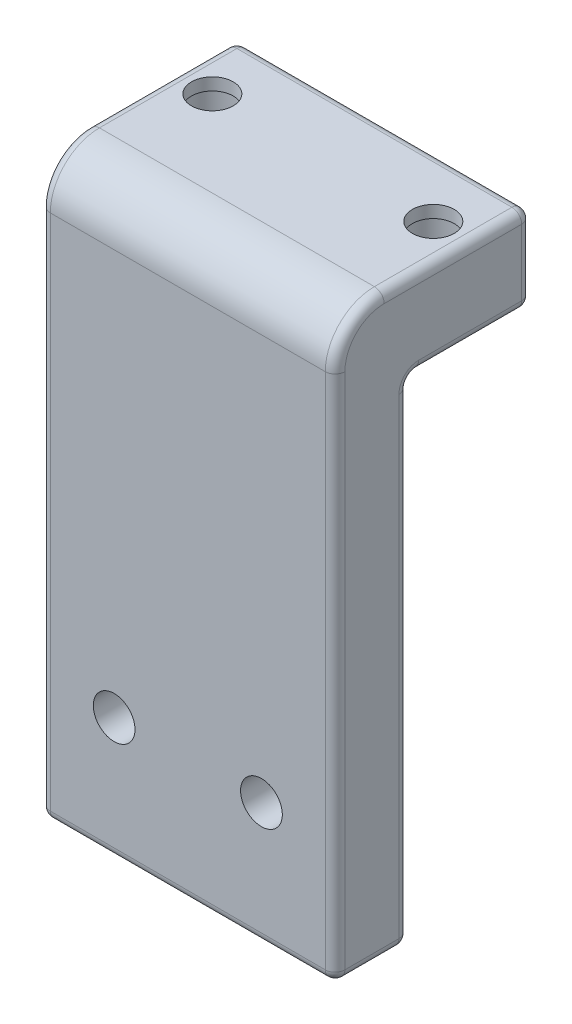
from build123d import *

# Parameters (mm, degrees)
SKETCH2_W           = 24
SKETCH2_H           = 47
BOSS_EXTRUDE1_DEPTH = 6
SKETCH3_W           = 24
SKETCH3_H           = 7
BOSS_EXTRUDE2_DEPTH = 10
HOLE1_OUTLINE_R     = 2.15
HOLE1_DEPTH         = 6
HOLE1_START         = 6
HOLE1_2_OUTLINE_R   = 1.7
HOLE1_2_DEPTH       = 1
FILLET1_R           = 4
FILLET2_R           = 0.8


# Read off the part's stored shape, not the designer's step: Hole1, CBORE for M3 SBHCS1
with BuildPart() as part:
    # Sketch2 → Boss-Extrude1 (new body)
    with BuildSketch(Plane.XY):
        with Locations((12, -16.5)):
            Rectangle(SKETCH2_W, SKETCH2_H)
    extrude(amount=BOSS_EXTRUDE1_DEPTH)

    # Sketch3 → Boss-Extrude2 (add)
    with BuildSketch(Plane(origin=(0, 0, 0), x_dir=(-1, 0, 0), z_dir=(0, 0, -1))):
        with Locations((-12, 3.5)):
            Rectangle(SKETCH3_W, SKETCH3_H)
    extrude(amount=BOSS_EXTRUDE2_DEPTH)

    # Hole1 outline → Hole1 (cut)
    with BuildSketch(Plane(origin=(0, 0, 0), x_dir=(1, 0, 0), z_dir=(0, 1, 0))):
        with Locations((3, 5)):
            Circle(HOLE1_OUTLINE_R)
        with Locations((21, 5)):
            Circle(HOLE1_OUTLINE_R)
    extrude(amount=HOLE1_DEPTH, mode=Mode.SUBTRACT)

    # Hole1 2 outline → Hole1 2 (cut)
    with BuildSketch(Plane(origin=(0, 0, 0), x_dir=(1, 0, 0), z_dir=(0, 1, 0)).offset(HOLE1_START)):
        with Locations((3, 5)):
            Circle(HOLE1_2_OUTLINE_R)
        with Locations((21, 5)):
            Circle(HOLE1_2_OUTLINE_R)
    extrude(amount=HOLE1_2_DEPTH, mode=Mode.SUBTRACT)

    # CBORE for M3 SBHCS1 outline → CBORE for M3 SBHCS1 (revolve, cut)
    with BuildSketch(Plane(origin=(18, -30, 0), x_dir=(1, 0, 0), z_dir=(0, -1, 0))):
        Polygon((1.7, 1.65), (1.7, 6), (0, 6), (0, 0), (3.375, 0), (3.35, 0.025), (3.35, 1.65), align=None)
    revolve(axis=Axis((18, -30, 0), (0, 0, 1)), mode=Mode.SUBTRACT)

    # CBORE for M3 SBHCS1 2 outline → CBORE for M3 SBHCS1 2 (revolve, cut)
    with BuildSketch(Plane(origin=(6, -30, 0), x_dir=(1, 0, 0), z_dir=(0, -1, 0))):
        Polygon((0, 0), (3.375, 0), (3.35, 0.025), (3.35, 1.65), (1.7, 1.65), (1.7, 6), (0, 6), align=None)
    revolve(axis=Axis((6, -30, 0), (0, 0, 1)), mode=Mode.SUBTRACT)

    # Fillet1
    fillet1_edges = [part.edges().sort_by_distance(p)[0] for p in [
        (12, 7, 6),
    ]]
    fillet(fillet1_edges, radius=FILLET1_R)

    # Fillet2
    fillet2_edges = [part.edges().sort_by_distance(p)[0] for p in [
        (24, -40, 3),
        (0, -40, 3),
        (12, -40, 6),
        (24, -18.5, 6),
        (12, 0, 0),
        (24, 0, -5),
        (0, 0, -5),
        (24, 3.5, -10),
        (12, 0, -10),
        (0, 3.5, -10),
        (12, 7, -10),
        (0, -18.5, 6),
        (24, 7, -4),
        (0, 7, -4),
        (24, 5.828427125, 4.828427125),
        (24, -20, 0),
        (0, 5.828427125, 4.828427125),
        (12, -40, 0),
        (0, -20, 0),
    ]]
    fillet(fillet2_edges, radius=FILLET2_R)


solid = part.part
